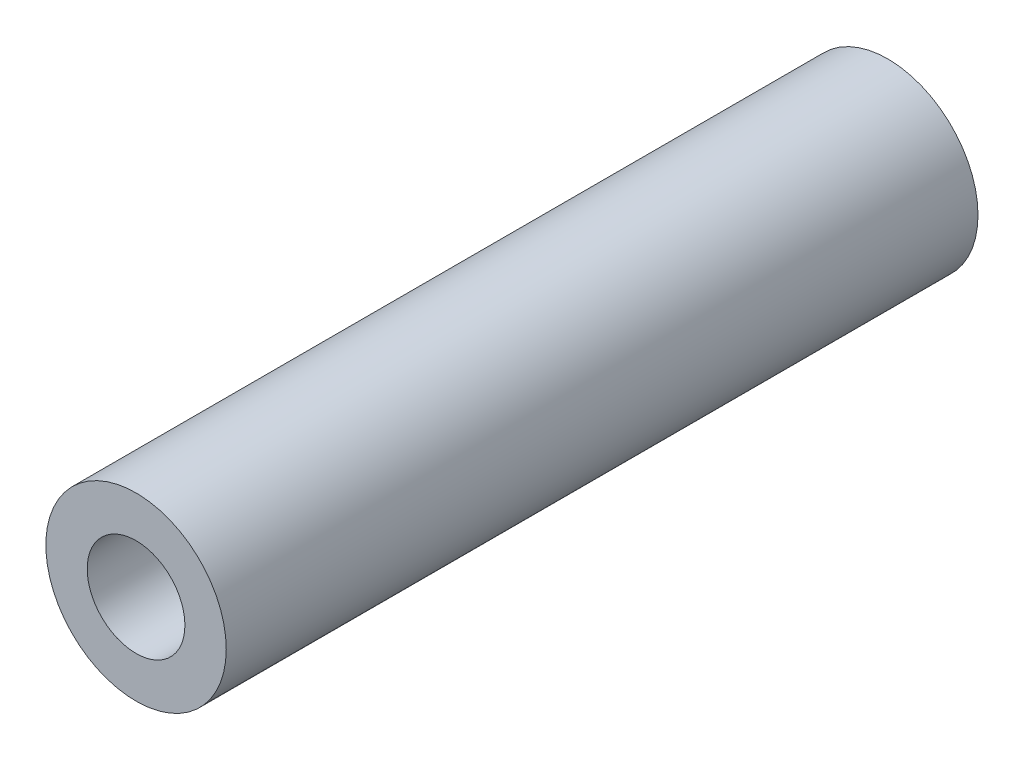
from build123d import *

# Parameters (mm, degrees)
SKETCH1_R           = 2.4
BOSS_EXTRUDE1_DEPTH = 20
SKETCH2_R           = 1.3
CUT_EXTRUDE1_DEPTH  = 2.5


with BuildPart() as part:
    # Sketch1 → Boss-Extrude1 (new body)
    with BuildSketch(Plane.XY):
        Circle(SKETCH1_R)
    extrude(amount=BOSS_EXTRUDE1_DEPTH)

    # Sketch2 → Cut-Extrude1 (cut)
    with BuildSketch(Plane.XY.offset(20)):
        Circle(SKETCH2_R)
    extrude(amount=-CUT_EXTRUDE1_DEPTH, mode=Mode.SUBTRACT)


solid = part.part
